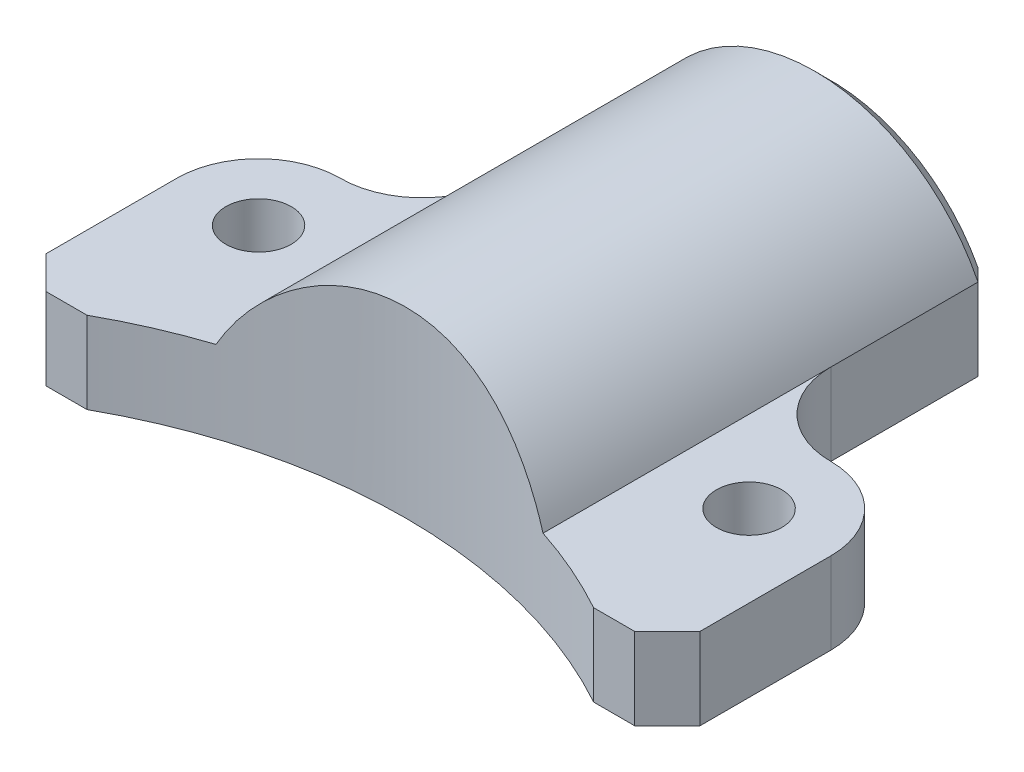
from build123d import *

# Parameters (mm, degrees)
SKETCH1_W           = 40
SKETCH1_H           = 30
BOSS_EXTRUDE1_DEPTH = 5
SKETCH3_W           = 20
SKETCH3_H           = 30
BOSS_EXTRUDE2_DEPTH = 7.5
CUT_EXTRUDE1_DEPTH  = 39.160843806
SKETCH5_W           = 10
SKETCH5_H           = 15
CUT_EXTRUDE2_DEPTH  = 26.752603774
SKETCH6_R           = 4
CUT_EXTRUDE3_DEPTH  = 20
CHAMFER1_SIZE       = 1
FILLET1_R           = 5
SKETCH7_R           = 2
CUT_EXTRUDE4_DEPTH  = 28.386127875
CHAMFER2_SIZE       = 2
SKETCH8_R           = 32
CUT_EXTRUDE5_DEPTH  = 28.386127875


with BuildPart() as part:
    # Sketch1 → Boss-Extrude1 (new body)
    with BuildSketch(Plane(origin=(0, 0, 0), x_dir=(1, 0, 0), z_dir=(0, 1, 0))):
        Rectangle(SKETCH1_W, SKETCH1_H)
    extrude(amount=BOSS_EXTRUDE1_DEPTH)

    # Sketch3 → Boss-Extrude2 (add)
    with BuildSketch(Plane(origin=(0, 5, 0), x_dir=(1, 0, 0), z_dir=(0, 1, 0))):
        Rectangle(SKETCH3_W, SKETCH3_H)
    extrude(amount=BOSS_EXTRUDE2_DEPTH)

    # Sketch4 → Cut-Extrude1 (cut, through all)
    with BuildSketch(Plane(origin=(0, 0, -15), x_dir=(-1, 0, 0), z_dir=(0, 0, -1))):
        with BuildLine():
            Line((-10, 5), (-10, 21.180339887))
            Line((-10, 21.180339887), (10, 21.180339887))
            Line((10, 21.180339887), (10, 5))
            ThreePointArc((10, 5), (0, 11.180339887), (-10, 5))
        make_face()
    extrude(amount=-CUT_EXTRUDE1_DEPTH, mode=Mode.SUBTRACT)

    # Sketch5 → Cut-Extrude2 (cut, through all)
    with BuildSketch(Plane(origin=(0, 5, 0), x_dir=(1, 0, 0), z_dir=(0, 1, 0))):
        with Locations((-15, 7.5)):
            Rectangle(SKETCH5_W, SKETCH5_H)
        with Locations((15, 7.5)):
            Rectangle(SKETCH5_W, SKETCH5_H)
    extrude(amount=-CUT_EXTRUDE2_DEPTH, mode=Mode.SUBTRACT)

    # Sketch6 → Cut-Extrude3 (cut)
    with BuildSketch(Plane(origin=(0, 0, -15), x_dir=(-1, 0, 0), z_dir=(0, 0, -1))):
        Circle(SKETCH6_R)
    extrude(amount=-CUT_EXTRUDE3_DEPTH, mode=Mode.SUBTRACT)

    # Chamfer1
    chamfer1_edges = [part.edges().sort_by_distance(p)[0] for p in [
        (0, 11.180339887, -15),
        (-10, 2.5, -15),
        (10, 2.5, -15),
        (0, 4, -15),
    ]]
    chamfer(chamfer1_edges, length=CHAMFER1_SIZE)

    # Fillet1
    fillet1_edges = [part.edges().sort_by_distance(p)[0] for p in [
        (10, 2.5, 0),
        (-10, 2.5, 0),
    ]]
    fillet(fillet1_edges, radius=FILLET1_R)
    fillet1_2_edges = [part.edges().sort_by_distance(p)[0] for p in [
        (20, 2.5, 0),
        (-20, 2.5, 0),
    ]]
    fillet(fillet1_2_edges, radius=FILLET1_R - 0.0001)  # a hair under: the kernel refuses the full size

    # Sketch7 → Cut-Extrude4 (cut, through all)
    with BuildSketch(Plane.XZ):
        with Locations(Location((-15, 5, 0), (0, 0, 270))):
            Circle(SKETCH7_R)
        with Locations(Location((15, 5, 0), (0, 0, 270))):
            Circle(SKETCH7_R)
    extrude(amount=-CUT_EXTRUDE4_DEPTH, mode=Mode.SUBTRACT)

    # Chamfer2
    chamfer2_edges = [part.edges().sort_by_distance(p)[0] for p in [
        (20, 2.5, 15),
        (-20, 2.5, 15),
    ]]
    chamfer(chamfer2_edges, length=CHAMFER2_SIZE)

    # Sketch8 → Cut-Extrude5 (cut, through all)
    with BuildSketch(Plane.XZ):
        with Locations((0, 43)):
            Circle(SKETCH8_R)
    extrude(amount=-CUT_EXTRUDE5_DEPTH, mode=Mode.SUBTRACT)


solid = part.part
